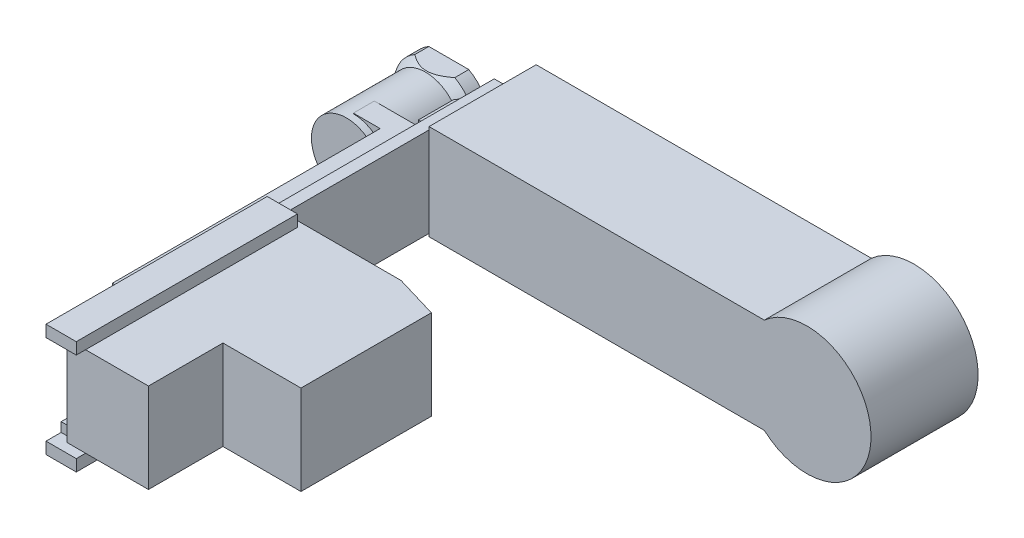
from build123d import *

# Parameters (mm, degrees)
CROQUIS1_R                 = 55
SALIENTE_EXTRUIR1_DEPTH    = 92
CROQUIS2_W                 = 287.965144552
CROQUIS2_H                 = 82
SALIENTE_EXTRUIR2_DEPTH    = 92
CROQUIS5_W                 = 372
CROQUIS5_H                 = 8
SALIENTE_EXTRUIR5_DEPTH    = 10
SALIENTE_EXTRUIR6_START    = -77
SALIENTE_EXTRUIR6_DEPTH    = 77
VACIADO1_START             = -28.5
VACIADO1_DEPTH             = 57
VACIADO1_START_2           = 10
VACIADO1_2_DEPTH           = 72
CROQUIS8_W                 = 26
CROQUIS8_H                 = 190
SALIENTE_EXTRUIR7_DEPTH    = 10
CROQUIS9_W                 = 26
CROQUIS9_H                 = 190
SALIENTE_EXTRUIR8_DEPTH    = 10
SALIENTE_EXTRUIR9_DEPTH    = 61
CORTAR_EXTRUIR1_DEPTH      = 69
CORTAR_EXTRUIR1_DEPTH_BACK = 16
CORTAR_EXTRUIR2_DEPTH      = 514.698364466
CORTAR_EXTRUIR2_DEPTH_BACK = 514.698364466
CROQUIS14_R                = 4.5
VACIADO4_START             = -354.625750112
VACIADO4_OUTLINE_W         = 41
VACIADO4_OUTLINE_H         = 238
VACIADO4_DEPTH             = 20
CROQUIS15_W                = 45
CROQUIS15_H                = 41
SALIENTE_EXTRUIR10_DEPTH   = 30


# Read off the part's stored shape, not the designer's step: Vaciado1, Vaciado4
with BuildPart() as part:
    # Croquis1 → Saliente-Extruir1 (new body)
    with BuildSketch(Plane.XY):
        Circle(CROQUIS1_R)
    extrude(amount=SALIENTE_EXTRUIR1_DEPTH)

    # Croquis2 → Saliente-Extruir2 (add)
    with BuildSketch(Plane(origin=(0, 0, 0), x_dir=(-1, 0, 0), z_dir=(0, 0, -1))):
        with Locations((180.643177836, 0)):
            Rectangle(CROQUIS2_W, CROQUIS2_H)
    extrude(amount=-SALIENTE_EXTRUIR2_DEPTH)

    # Croquis5 → Saliente-Extruir5 (add)
    with BuildSketch(Plane.ZY.offset(324.625750112)):
        with Locations((212, 34.5)):
            Rectangle(CROQUIS5_W, CROQUIS5_H)
        with Locations((212, -34.5)):
            Rectangle(CROQUIS5_W, CROQUIS5_H)
    extrude(amount=SALIENTE_EXTRUIR5_DEPTH)

    # Croquis6 → Saliente-Extruir6 (add)
    with BuildSketch(Plane.XZ.offset(38.5).offset(SALIENTE_EXTRUIR6_START)):
        Polygon((-324.625750112, 216), (-224.625750112, 216), (-187.625750112, 227.033203383), (-187.625750112, 339), (-254.625750112, 339), (-254.625750112, 403), (-324.625750112, 403), align=None)
    extrude(amount=SALIENTE_EXTRUIR6_DEPTH)

    # Vaciado1 outline → Vaciado1 (cut)
    with BuildSketch(Plane(origin=(0, 0, 0), x_dir=(1, 0, 0), z_dir=(0, 1, 0)).offset(VACIADO1_START)):
        Polygon((-197.625750112, -234.486389827), (-226.08497566, -226), (-324.625750112, -226), (-324.625750112, -393), (-264.625750112, -393), (-264.625750112, -329), (-197.625750112, -329), align=None)
    extrude(amount=VACIADO1_DEPTH, mode=Mode.SUBTRACT)

    # Vaciado1 2 outline → Vaciado1 2 (cut)
    with BuildSketch(Plane.XY.offset(VACIADO1_START_2)):
        with BuildLine():
            Line((-32.619012861, 31), (-314.625750112, 31))
            Line((-314.625750112, 31), (-314.625750112, -31))
            Line((-314.625750112, -31), (-32.619012861, -31))
            ThreePointArc((-32.619012861, -31), (45, 0), (-32.619012861, 31))
        make_face()
    extrude(amount=VACIADO1_2_DEPTH, mode=Mode.SUBTRACT)

    # Croquis8 → Saliente-Extruir7 (add)
    with BuildSketch(Plane(origin=(0, 38.5, 0), x_dir=(1, 0, 0), z_dir=(0, 1, 0))):
        with Locations((-321.625750112, -316)):
            Rectangle(CROQUIS8_W, CROQUIS8_H)
    extrude(amount=SALIENTE_EXTRUIR7_DEPTH)

    # Croquis9 → Saliente-Extruir8 (add)
    with BuildSketch(Plane.XZ.offset(38.5)):
        with Locations((-321.625750112, 316)):
            Rectangle(CROQUIS9_W, CROQUIS9_H)
    extrude(amount=SALIENTE_EXTRUIR8_DEPTH)

    # Croquis10 → Saliente-Extruir9 (add)
    with BuildSketch(Plane.XZ.offset(-30.5)):
        Polygon((-324.625750112, 86), (-377.625750112, 86), (-377.625750112, 104), (-354.625750112, 104), (-354.625750112, 334), (-324.625750112, 334), align=None)
    extrude(amount=SALIENTE_EXTRUIR9_DEPTH)

    # Croquis11 → Revolución1 (revolve)
    with BuildSketch(Plane.ZY.offset(377.625750112)):
        Polygon((110, 0), (110, 30), (42, 30), (34, 35), (22, 35), (22, 0), align=None)
    revolve(axis=Axis((-377.625750112, 0, 0), (0, 0, 1)))

    # Croquis13 → Cortar-Extruir1 (cut, two sides: drawn at the far end of the back side and taken through both)
    with BuildSketch(Plane.ZY.offset(354.625750112).offset(-CORTAR_EXTRUIR1_DEPTH_BACK)):
        Polygon((48.064346335, 30.5), (14.405684341, 30.5), (14.405684341, 38.395591982), (46.194420669, 38.5), align=None)
        Polygon((43.319665348, -30.5), (18.175664467, -30.5), (19.260307642, -37.859564216), (38.945879671, -34.958329751), align=None)
    extrude(amount=CORTAR_EXTRUIR1_DEPTH + CORTAR_EXTRUIR1_DEPTH_BACK, mode=Mode.SUBTRACT)

    # Croquis14 → Cortar-Extruir2 (cut, two sides: drawn at the far end of the back side and taken through both)
    with BuildSketch(Plane.XY.offset(110).offset(-CORTAR_EXTRUIR2_DEPTH_BACK)):
        with Locations(Location((-377.625750112, 0, 0), (0, 0, 90))):
            Circle(CROQUIS14_R)
    extrude(amount=CORTAR_EXTRUIR2_DEPTH + CORTAR_EXTRUIR2_DEPTH_BACK, mode=Mode.SUBTRACT)

    # Vaciado4 outline → Vaciado4 (cut)
    with BuildSketch(Plane.YZ.offset(VACIADO4_START)):
        with Locations((0, 215)):
            Rectangle(VACIADO4_OUTLINE_W, VACIADO4_OUTLINE_H)
    extrude(amount=VACIADO4_DEPTH, mode=Mode.SUBTRACT)

    # Croquis15 → Saliente-Extruir10 (add)
    with BuildSketch(Plane.ZY.offset(324.625750112)):
        with Locations((48.5, 0)):
            Rectangle(CROQUIS15_W, CROQUIS15_H)
    extrude(amount=SALIENTE_EXTRUIR10_DEPTH)


solid = part.part
